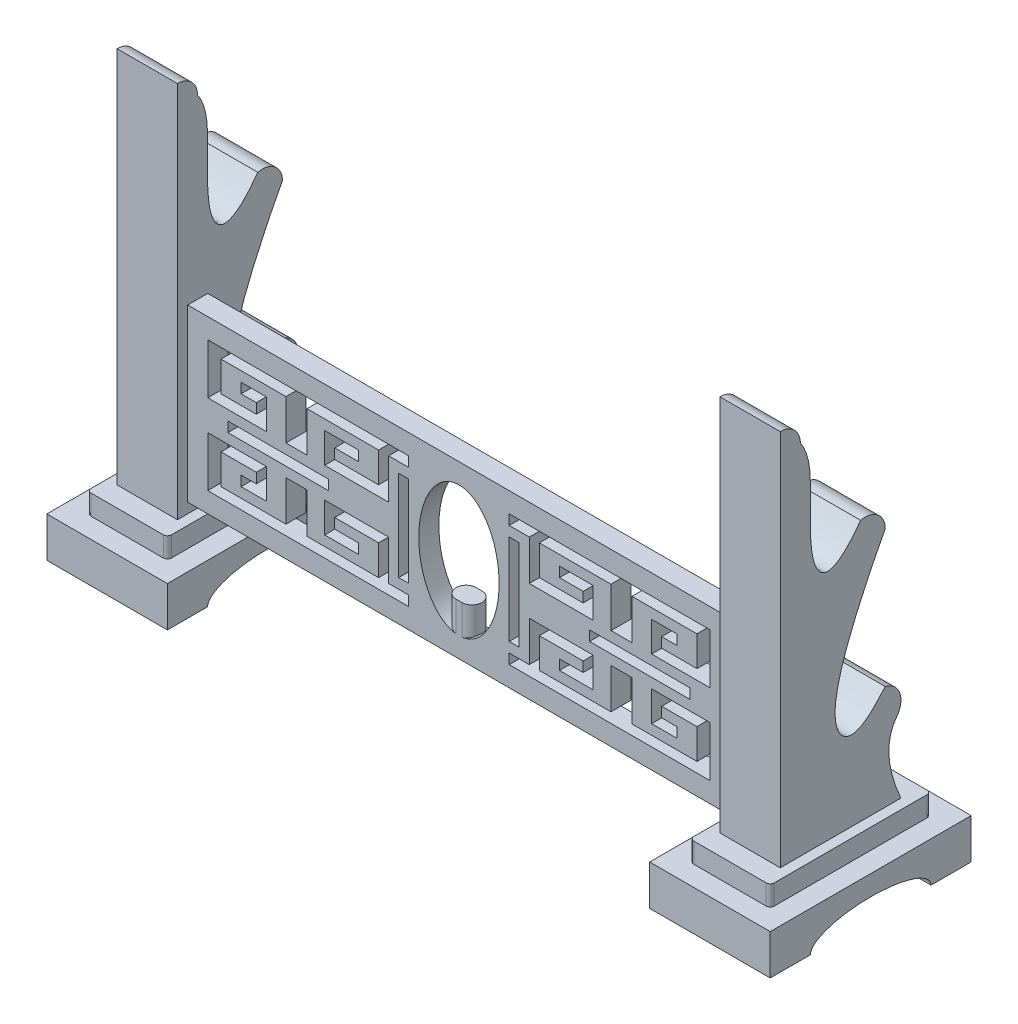
from build123d import *

# Parameters (mm, degrees)
BOSS_EXTRUDE2_DEPTH = 25.4
BOSS_EXTRUDE3_DEPTH = 12.7
CUT_EXTRUDE1_DEPTH  = 76.2
BOSS_EXTRUDE4_START = -19.05
BOSS_EXTRUDE4_DEPTH = 38.1
SKETCH8_W           = 12.700000000000003
SKETCH8_H           = 107.94999999999999
BOSS_EXTRUDE6_DEPTH = 171.45
SKETCH9_RX          = 41.27499999999998
SKETCH9_RY          = 25.399999999999977
CUT_EXTRUDE2_DEPTH  = 12.7
BOSS_EXTRUDE7_DEPTH = 25.399999999999984


# Read off the part's stored shape, not the designer's step: Boss-Extrude4, Mirror6
with BuildPart() as part:
    # Sketch3 → Boss-Extrude2 (new body)
    with BuildSketch(Plane(origin=(0, 0, 0), x_dir=(1, 0, 0), z_dir=(0, 1, 0))):
        Polygon((152.4, -63.5), (152.39999999999998, 63.5), (228.59999999999997, 63.5), (228.6, -63.49999999999997), align=None)
    extrude(amount=BOSS_EXTRUDE2_DEPTH)

    # Sketch4 → Boss-Extrude3 (add)
    with BuildSketch(Plane(origin=(0, 25.4, 0), x_dir=(1, 0, 0), z_dir=(0, 1, 0))):
        with BuildLine():
            Line((167.64000000000001, 50.800000000000004), (213.36, 50.800000000000004))
            ThreePointArc((213.36, 50.800000000000004), (215.15605122421385, 50.05605122421383), (215.9, 48.260000000000005))
            Line((215.9, 48.260000000000005), (215.9, -48.26))
            ThreePointArc((215.9, -48.26), (215.15605122421385, -50.05605122421383), (213.36, -50.8))
            Line((213.36, -50.8), (167.64000000000001, -50.8))
            ThreePointArc((167.64000000000001, -50.8), (165.8439487757862, -50.056051224213824), (165.10000000000002, -48.26))
            Line((165.10000000000002, -48.26), (165.10000000000002, 48.260000000000005))
            ThreePointArc((165.10000000000002, 48.260000000000005), (165.84394877578617, 50.05605122421384), (167.64000000000001, 50.800000000000004))
        make_face()
    extrude(amount=BOSS_EXTRUDE3_DEPTH)

    # Sketch5 → Cut-Extrude1 (cut)
    with BuildSketch(Plane(origin=(228.6, 0, -4.996e-14), x_dir=(-2.7e-16, 0, -1), z_dir=(1, 0, -2.7e-16))):
        with BuildLine():
            Line((-38.1, 0), (38.1, 0))
            add(Edge.make_bspline(
                [(38.1, 0), (38.09999999999999, 12.699999999999998), (8.55e-15, 12.7), (-38.09999999999999, 12.700000000000008), (-38.1, 0)],
                knots=[3.1415926535897936, 3.1415926535897936, 3.1415926535897936, 4.71238898038469, 4.71238898038469, 6.283185307179586, 6.283185307179586, 6.283185307179586], degree=2, weights=[1, 0.7071067811865476, 1, 0.7071067811865476, 1]))
        make_face()
    extrude(amount=-CUT_EXTRUDE1_DEPTH, mode=Mode.SUBTRACT)

    # Boss-Extrude4 outline → Boss-Extrude4 (add)
    with BuildSketch(Plane(origin=(190.5, 0, 0), x_dir=(0, 0, -1), z_dir=(1, 0, 0)).offset(BOSS_EXTRUDE4_START)):
        with BuildLine():
            Line((-38.1, 38.1), (38.1, 38.1))
            add(Edge.make_bspline(
                [(38.1, 38.1), (24.3218178105019, 69.3505379290592), (35.56, 84.028856923)],
                knots=[0, 0, 0, 1, 1, 1], degree=2))
            ThreePointArc((35.56, 84.028856923), (37.41446141, 96.081447917), (28.262209495, 104.14))
            add(Edge.make_bspline(
                [(28.262209495, 104.14), (14.1603090339909, 88.3482325257599), (0, 71.4976153835242), (-9.83779050454483, 100.283205593229), (-5.01179050454483, 106.803670348209), (-5.89994946867073, 126.462723680817), (28.262209495, 190.5)],
                knots=[0, 0, 0, 0, 0, 0, 0, 1, 1, 1, 1, 1, 1, 1], degree=6))
            ThreePointArc((28.262209495, 190.5), (23.466004135, 200.440826439), (12.7, 202.87326783))
            add(Edge.make_bspline(
                [(12.7, 202.87326783), (-5.39630107853778, 177.727276832893), (-19.05, 177.727276832893), (-19.05, 215.9)],
                knots=[0, 0, 0, 0, 1, 1, 1, 1], degree=3))
            Line((-19.05, 215.9), (-19.05, 238.76))
            add(Edge.make_bspline(
                [(-19.05, 238.76), (-19.05, 255.313188384262), (-25.4, 264.16)],
                knots=[0, 0, 0, 1, 1, 1], degree=2))
            ThreePointArc((-25.4, 264.16), (-29.119743879, 273.140256121), (-38.1, 276.86))
            Line((-38.1, 276.86), (-38.1, 38.1))
        make_face()
    extrude(amount=BOSS_EXTRUDE4_DEPTH)

    # Sketch8 → Boss-Extrude6 (add)
    with BuildSketch(Plane(origin=(0, 0, 0), x_dir=(0, 0, -1), z_dir=(1, 0, 0))):
        with Locations((-25.27818899062787, 98.42499999999998)):
            Rectangle(SKETCH8_W, SKETCH8_H)
    extrude(amount=BOSS_EXTRUDE6_DEPTH)

    # Mirror6: part across plane


with BuildPart() as part_1:
    add(part.part)
    add(part.part.mirror(Plane(origin=(0, 0, 0), x_dir=(0, 0, 1), z_dir=(1, 0, 0))))

    # Sketch9 → Cut-Extrude2 (cut)
    with BuildSketch(Plane(origin=(0, 0, 18.92818899062787), x_dir=(-1, 0, 0), z_dir=(0, 0, -1))):
        Polygon((-158.75, 139.7), (-31.75, 139.69999999999996), (-31.75, 133.3499999999999), (-44.45, 133.34999999999988), (-44.45, 107.94999999999999), (-84.86236743472247, 107.94999999999999), (-84.86236743472247, 126.99999999999991), (-63.5, 126.99999999999997), (-63.5, 120.64999999999998), (-78.51236743472248, 120.64999999999998), (-78.51236743472248, 114.29999999999998), (-50.800000000000004, 114.29999999999998), (-50.800000000000004, 133.34999999999997), (-96.07894200613661, 133.3499999999999), (-96.07894200613661, 107.94999999999999), (-109.34126035009214, 107.94999999999999), (-109.34126035009214, 133.34999999999994), (-150.402014255055, 133.34999999999994), (-150.402014255055, 114.29999999999997), (-128.10263487264285, 114.29999999999997), (-128.10263487264285, 120.64999999999996), (-137.70201425505502, 120.64999999999996), (-137.70201425505502, 126.99999999999994), (-121.75263487264284, 126.99999999999994), (-121.75263487264284, 107.94999999999999), (-158.75, 107.94999999999999), align=None)
        Polygon((-96.07894200613661, 63.50000000000006), (-50.800000000000004, 63.5), (-50.800000000000004, 82.54999999999998), (-78.51236743472248, 82.54999999999998), (-78.51236743472248, 76.19999999999999), (-63.5, 76.19999999999999), (-63.5, 69.85), (-84.86236743472247, 69.85000000000005), (-84.86236743472247, 88.89999999999998), (-44.45, 88.89999999999998), (-44.45, 63.500000000000085), (-31.75, 63.50000000000006), (-31.75, 57.150000000000006), (-158.75, 57.14999999999998), (-158.75, 88.89999999999998), (-121.75263487264284, 88.89999999999998), (-121.75263487264284, 69.85000000000002), (-137.70201425505502, 69.85000000000002), (-137.70201425505502, 76.2), (-128.10263487264285, 76.2), (-128.10263487264285, 82.55), (-150.402014255055, 82.55), (-150.402014255055, 63.50000000000003), (-109.34126035009214, 63.50000000000003), (-109.34126035009214, 88.89999999999998), (-96.07894200613661, 88.89999999999998), align=None)
        with Locations(Location((0, 98.42499999999998), (0, 0, 90))):
            Ellipse(SKETCH9_RX, SKETCH9_RY)
        Polygon((96.07894200613661, 133.3499999999999), (50.800000000000004, 133.34999999999997), (50.800000000000004, 114.29999999999998), (78.51236743472248, 114.29999999999998), (78.51236743472248, 120.64999999999998), (63.5, 120.64999999999998), (63.5, 126.99999999999997), (84.86236743472247, 126.99999999999991), (84.86236743472247, 107.94999999999999), (44.45, 107.94999999999999), (44.45, 133.34999999999988), (31.75, 133.3499999999999), (31.75, 139.69999999999996), (158.75, 139.7), (158.75, 107.94999999999999), (121.75263487264284, 107.94999999999999), (121.75263487264284, 126.99999999999994), (137.70201425505502, 126.99999999999994), (137.70201425505502, 120.64999999999996), (128.10263487264285, 120.64999999999996), (128.10263487264285, 114.29999999999997), (150.402014255055, 114.29999999999997), (150.402014255055, 133.34999999999994), (109.34126035009214, 133.34999999999994), (109.34126035009214, 107.94999999999999), (96.07894200613661, 107.94999999999999), align=None)
        Polygon((158.75, 57.14999999999998), (31.75, 57.150000000000006), (31.75, 63.50000000000006), (44.45, 63.500000000000085), (44.45, 88.89999999999998), (84.86236743472247, 88.89999999999998), (84.86236743472247, 69.85000000000005), (63.5, 69.85), (63.5, 76.19999999999999), (78.51236743472248, 76.19999999999999), (78.51236743472248, 82.54999999999998), (50.800000000000004, 82.54999999999998), (50.800000000000004, 63.5), (96.07894200613661, 63.50000000000006), (96.07894200613661, 88.89999999999998), (109.34126035009214, 88.89999999999998), (109.34126035009214, 63.50000000000003), (150.402014255055, 63.50000000000003), (150.402014255055, 82.55), (128.10263487264285, 82.55), (128.10263487264285, 76.2), (137.70201425505502, 76.2), (137.70201425505502, 69.85000000000002), (121.75263487264284, 69.85000000000002), (121.75263487264284, 88.89999999999998), (158.75, 88.89999999999998), align=None)
        Polygon((-82.54999999999995, 95.24999999999997), (-146.04999999999995, 95.25), (-146.04999999999995, 101.59999999999997), (-82.54999999999995, 101.59999999999997), align=None)
        Polygon((-38.09999999999997, 126.99999999999997), (-38.09999999999998, 69.85), (-31.74999999999998, 69.84999999999982), (-31.74999999999997, 127.00000000000011), align=None)
        Polygon((31.74999999999997, 127.00000000000011), (31.74999999999998, 69.84999999999982), (38.09999999999998, 69.85), (38.09999999999997, 126.99999999999997), align=None)
        Polygon((82.54999999999995, 101.59999999999997), (82.54999999999995, 95.24999999999997), (146.04999999999995, 95.25), (146.04999999999995, 101.59999999999997), align=None)
    extrude(amount=-CUT_EXTRUDE2_DEPTH, mode=Mode.SUBTRACT)

    # Sketch10 → Boss-Extrude7 (add)
    with BuildSketch(Plane(origin=(0, 50.8, 0), x_dir=(1, 0, 0), z_dir=(0, 1, 0))):
        with BuildLine():
            Line((-1.8287999999999993, -18.92818899062787), (1.8287999999999993, -18.92818899062787))
            ThreePointArc((1.8287999999999993, -18.92818899062787), (8.1788, -25.27818899062787), (1.8287999999999993, -31.628188990627873))
            Line((1.8287999999999993, -31.628188990627873), (-1.8287999999999993, -31.628188990627873))
            ThreePointArc((-1.8287999999999993, -31.628188990627873), (-8.1788, -25.27818899062787), (-1.8287999999999993, -18.92818899062787))
        make_face()
    extrude(amount=BOSS_EXTRUDE7_DEPTH)


solid = part_1.part
